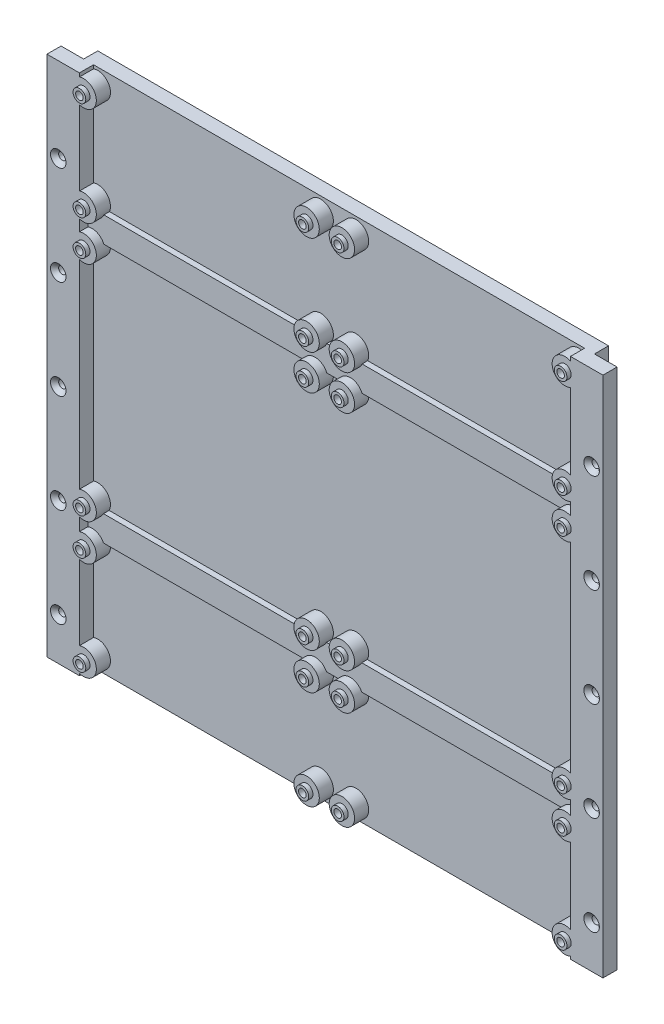
from build123d import *

# Parameters (mm, degrees)
MAIN_SKETCH_W                                  = 181
MAIN_SKETCH_H                                  = 185
MAIN_EXTRUSION_DEPTH                           = 2.5
HORIZONTAL_STRUCTURE_SKETCH_W                  = 181
HORIZONTAL_STRUCTURE_SKETCH_H                  = 5
HORIZONTAL_STRUCTURE_EXTRUSION_DEPTH           = 2.5
HORIZONTAL_STRUCTURE_LINEAR_REPEAT_COUNT       = 10
HORIZONTAL_STRUCTURE_LINEAR_REPEAT_PITCH       = 20
VERTICAL_STRUCTURE_SKETCH_W                    = 5
VERTICAL_STRUCTURE_SKETCH_H                    = 185
VERTICAL_STRUCTURE_EXTRUSION_DEPTH             = 2.5
VERTICAL_STRUCTURE_LINEAR_REPEAT_COUNT         = 9
VERTICAL_STRUCTURE_LINEAR_REPEAT_PITCH         = 22
PLOT_BASE_SKETCH_R                             = 4.5
PLOT_BASE_EXTRUSION_DEPTH                      = 5
PLOT_HEAD_SKETCH_R                             = 2.25
PLOT_HEAD_EXTRUSION_DEPTH                      = 1.5
PLOT_HEAD_HOLE_SKETCH_R                        = 1.35
PLOT_HEAD_HOLE_DEPTH                           = 130.918243523
MECHANICAL_BOARD_BOARD_FIRST_VERTICAL_COUNT    = 2
MECHANICAL_BOARD_BOARD_FIRST_VERTICAL_PITCH    = 35
MECHANICAL_MAIN_BOARD_FIRST_VERTICAL_L_COUNT   = 2
MECHANICAL_MAIN_BOARD_FIRST_VERTICAL_L_PITCH   = 48
MECHANICAL_MAIN_BOARD_SECOND_VERTICAL_COUNT    = 2
MECHANICAL_MAIN_BOARD_SECOND_VERTICAL_PITCH    = 127
MECHANICAL_MOTOR_BOARD_FIRST_VERTICAL_COUNT    = 2
MECHANICAL_MOTOR_BOARD_FIRST_VERTICAL_PITCH    = 139.5
MECHANICAL_MOTOR_BOARD_SECOND_VERTICAL_COUNT   = 2
MECHANICAL_MOTOR_BOARD_SECOND_VERTICAL_PITCH   = 174.5
RANGE_2_LINEAR_REPEAT_COUNT                    = 2
RANGE_2_LINEAR_REPEAT_PITCH                    = 79
RANGE_2_LINEAR_REPEAT_COPY_1_SKETCH_R          = 4.5
RANGE_2_LINEAR_REPEAT_COPY_1_DEPTH             = 5
RANGE_2_LINEAR_REPEAT_COPY_2_SKETCH_R          = 2.25
RANGE_2_LINEAR_REPEAT_COPY_2_DEPTH             = 1.5
RANGE_2_LINEAR_REPEAT_COPY_3_SKETCH_R          = 1.35
RANGE_2_LINEAR_REPEAT_COPY_3_DEPTH             = 130.918243523
RANGE_2_LINEAR_REPEAT_COPY_4_SKETCH_R          = 4.5
RANGE_2_LINEAR_REPEAT_COPY_4_DEPTH             = 5
RANGE_2_LINEAR_REPEAT_COPY_5_SKETCH_R          = 2.25
RANGE_2_LINEAR_REPEAT_COPY_5_DEPTH             = 1.5
RANGE_2_LINEAR_REPEAT_COPY_6_SKETCH_R          = 1.35
RANGE_2_LINEAR_REPEAT_COPY_6_DEPTH             = 130.918243523
RANGE_2_LINEAR_REPEAT_COPY_7_SKETCH_R          = 4.5
RANGE_2_LINEAR_REPEAT_COPY_7_DEPTH             = 5
RANGE_2_LINEAR_REPEAT_COPY_8_SKETCH_R          = 2.25
RANGE_2_LINEAR_REPEAT_COPY_8_DEPTH             = 1.5
RANGE_2_LINEAR_REPEAT_COPY_9_SKETCH_R          = 1.35
RANGE_2_LINEAR_REPEAT_COPY_9_DEPTH             = 130.918243523
RANGE_2_LINEAR_REPEAT_COPY_10_SKETCH_R         = 4.5
RANGE_2_LINEAR_REPEAT_COPY_10_DEPTH            = 5
RANGE_2_LINEAR_REPEAT_COPY_11_SKETCH_R         = 2.25
RANGE_2_LINEAR_REPEAT_COPY_11_DEPTH            = 1.5
RANGE_2_LINEAR_REPEAT_COPY_12_SKETCH_R         = 1.35
RANGE_2_LINEAR_REPEAT_COPY_12_DEPTH            = 130.918243523
RANGE_2_LINEAR_REPEAT_COPY_13_SKETCH_R         = 4.5
RANGE_2_LINEAR_REPEAT_COPY_13_DEPTH            = 5
RANGE_2_LINEAR_REPEAT_COPY_14_SKETCH_R         = 2.25
RANGE_2_LINEAR_REPEAT_COPY_14_DEPTH            = 1.5
RANGE_2_LINEAR_REPEAT_COPY_15_SKETCH_R         = 1.35
RANGE_2_LINEAR_REPEAT_COPY_15_DEPTH            = 130.918243523
RANGE_3_4_LINEAR_REPEAT_COUNT                  = 2
RANGE_3_4_LINEAR_REPEAT_PITCH                  = 91.5
RANGE_3_4_LINEAR_REPEAT_COPY_1_SKETCH_R        = 4.5
RANGE_3_4_LINEAR_REPEAT_COPY_1_DEPTH           = 5
RANGE_3_4_LINEAR_REPEAT_COPY_2_SKETCH_R        = 2.25
RANGE_3_4_LINEAR_REPEAT_COPY_2_DEPTH           = 1.5
RANGE_3_4_LINEAR_REPEAT_COPY_3_SKETCH_R        = 1.35
RANGE_3_4_LINEAR_REPEAT_COPY_3_DEPTH           = 130.918243523
RANGE_3_4_LINEAR_REPEAT_COPY_4_SKETCH_R        = 4.5
RANGE_3_4_LINEAR_REPEAT_COPY_4_DEPTH           = 5
RANGE_3_4_LINEAR_REPEAT_COPY_5_SKETCH_R        = 2.25
RANGE_3_4_LINEAR_REPEAT_COPY_5_DEPTH           = 1.5
RANGE_3_4_LINEAR_REPEAT_COPY_6_SKETCH_R        = 1.35
RANGE_3_4_LINEAR_REPEAT_COPY_6_DEPTH           = 130.918243523
RANGE_3_4_LINEAR_REPEAT_COPY_7_SKETCH_R        = 4.5
RANGE_3_4_LINEAR_REPEAT_COPY_7_DEPTH           = 5
RANGE_3_4_LINEAR_REPEAT_COPY_8_SKETCH_R        = 2.25
RANGE_3_4_LINEAR_REPEAT_COPY_8_DEPTH           = 1.5
RANGE_3_4_LINEAR_REPEAT_COPY_9_SKETCH_R        = 1.35
RANGE_3_4_LINEAR_REPEAT_COPY_9_DEPTH           = 130.918243523
RANGE_3_4_LINEAR_REPEAT_COPY_10_SKETCH_R       = 4.5
RANGE_3_4_LINEAR_REPEAT_COPY_10_DEPTH          = 5
RANGE_3_4_LINEAR_REPEAT_COPY_11_SKETCH_R       = 2.25
RANGE_3_4_LINEAR_REPEAT_COPY_11_DEPTH          = 1.5
RANGE_3_4_LINEAR_REPEAT_COPY_12_SKETCH_R       = 1.35
RANGE_3_4_LINEAR_REPEAT_COPY_12_DEPTH          = 130.918243523
RANGE_3_4_LINEAR_REPEAT_COPY_13_SKETCH_R       = 4.5
RANGE_3_4_LINEAR_REPEAT_COPY_13_DEPTH          = 5
RANGE_3_4_LINEAR_REPEAT_COPY_14_SKETCH_R       = 2.25
RANGE_3_4_LINEAR_REPEAT_COPY_14_DEPTH          = 1.5
RANGE_3_4_LINEAR_REPEAT_COPY_15_SKETCH_R       = 1.35
RANGE_3_4_LINEAR_REPEAT_COPY_15_DEPTH          = 130.918243523
RANGE_3_4_LINEAR_REPEAT_COPY_16_SKETCH_R       = 4.5
RANGE_3_4_LINEAR_REPEAT_COPY_16_DEPTH          = 5
RANGE_3_4_LINEAR_REPEAT_COPY_17_SKETCH_R       = 2.25
RANGE_3_4_LINEAR_REPEAT_COPY_17_DEPTH          = 1.5
RANGE_3_4_LINEAR_REPEAT_COPY_18_SKETCH_R       = 1.35
RANGE_3_4_LINEAR_REPEAT_COPY_18_DEPTH          = 130.918243523
RANGE_3_4_LINEAR_REPEAT_COPY_19_SKETCH_R       = 4.5
RANGE_3_4_LINEAR_REPEAT_COPY_19_DEPTH          = 5
RANGE_3_4_LINEAR_REPEAT_COPY_20_SKETCH_R       = 2.25
RANGE_3_4_LINEAR_REPEAT_COPY_20_DEPTH          = 1.5
RANGE_3_4_LINEAR_REPEAT_COPY_21_SKETCH_R       = 1.35
RANGE_3_4_LINEAR_REPEAT_COPY_21_DEPTH          = 130.918243523
RANGE_3_4_LINEAR_REPEAT_COPY_22_SKETCH_R       = 4.5
RANGE_3_4_LINEAR_REPEAT_COPY_22_DEPTH          = 5
RANGE_3_4_LINEAR_REPEAT_COPY_23_SKETCH_R       = 2.25
RANGE_3_4_LINEAR_REPEAT_COPY_23_DEPTH          = 1.5
RANGE_3_4_LINEAR_REPEAT_COPY_24_SKETCH_R       = 1.35
RANGE_3_4_LINEAR_REPEAT_COPY_24_DEPTH          = 130.918243523
RANGE_3_4_LINEAR_REPEAT_COPY_25_SKETCH_R       = 4.5
RANGE_3_4_LINEAR_REPEAT_COPY_25_DEPTH          = 5
RANGE_3_4_LINEAR_REPEAT_COPY_26_SKETCH_R       = 2.25
RANGE_3_4_LINEAR_REPEAT_COPY_26_DEPTH          = 1.5
RANGE_3_4_LINEAR_REPEAT_COPY_27_SKETCH_R       = 1.35
RANGE_3_4_LINEAR_REPEAT_COPY_27_DEPTH          = 130.918243523
RANGE_3_4_LINEAR_REPEAT_COPY_28_SKETCH_R       = 4.5
RANGE_3_4_LINEAR_REPEAT_COPY_28_DEPTH          = 5
RANGE_3_4_LINEAR_REPEAT_COPY_29_SKETCH_R       = 2.25
RANGE_3_4_LINEAR_REPEAT_COPY_29_DEPTH          = 1.5
RANGE_3_4_LINEAR_REPEAT_COPY_30_SKETCH_R       = 1.35
RANGE_3_4_LINEAR_REPEAT_COPY_30_DEPTH          = 130.918243523
RANGE_3_4_LINEAR_REPEAT_COPY_31_SKETCH_R       = 4.5
RANGE_3_4_LINEAR_REPEAT_COPY_31_DEPTH          = 5
RANGE_3_4_LINEAR_REPEAT_COPY_32_SKETCH_R       = 2.25
RANGE_3_4_LINEAR_REPEAT_COPY_32_DEPTH          = 1.5
RANGE_3_4_LINEAR_REPEAT_COPY_33_SKETCH_R       = 1.35
RANGE_3_4_LINEAR_REPEAT_COPY_33_DEPTH          = 130.918243523
FIX_SKETCH_W                                   = 11.5
FIX_SKETCH_H                                   = 185
FIX_EXTRUSION_DEPTH                            = 5
FRAISAGE_POUR_VIS_T_TE_FRAIS_E_M31_D           = 2.6
FRAISAGE_POUR_VIS_T_TE_FRAIS_E_M31_CSINK_D     = 5.5
FRAISAGE_POUR_VIS_T_TE_FRAIS_E_M31_CSINK_ANGLE = 90
R_P_TITION_LIN_AIRE11_COUNT                    = 5
R_P_TITION_LIN_AIRE11_PITCH                    = 35
SYM_TRIE1_COPY_1_D                             = 2.6
SYM_TRIE1_COPY_1_CSINK_D                       = 5.5
SYM_TRIE1_COPY_1_CSINK_ANGLE                   = 90
SYM_TRIE1_COPY_2_D                             = 2.6
SYM_TRIE1_COPY_2_CSINK_D                       = 5.5
SYM_TRIE1_COPY_2_CSINK_ANGLE                   = 90
SYM_TRIE1_COPY_3_D                             = 2.6
SYM_TRIE1_COPY_3_CSINK_D                       = 5.5
SYM_TRIE1_COPY_3_CSINK_ANGLE                   = 90
SYM_TRIE1_COPY_4_D                             = 2.6
SYM_TRIE1_COPY_4_CSINK_D                       = 5.5
SYM_TRIE1_COPY_4_CSINK_ANGLE                   = 90
CROSS_PLATE_1_W                                = 174
CROSS_PLATE_1_H                                = 9
CROSS_PLATE_1_EXTRUSION_DEPTH                  = 2
CROSS_PLATE_2_SKETCH_W                         = 174
CROSS_PLATE_2_SKETCH_H                         = 9
CROSS_PLATE_2_EXTRUSION_DEPTH                  = 2


with BuildPart() as part:
    # Main - Sketch → Main - Extrusion (new body)
    with BuildSketch(Plane.XY):
        Rectangle(MAIN_SKETCH_W, MAIN_SKETCH_H)
    extrude(amount=MAIN_EXTRUSION_DEPTH)

    # Horizontal Structure - Sketch → Horizontal Structure - Extrusion (add)
    with BuildSketch(Plane(origin=(0, 0, 0), x_dir=(-1, 0, 0), z_dir=(0, 0, -1))):
        with Locations((0, -90)):
            Rectangle(HORIZONTAL_STRUCTURE_SKETCH_W, HORIZONTAL_STRUCTURE_SKETCH_H)
    horizontal_structure_extrusion = extrude(amount=HORIZONTAL_STRUCTURE_EXTRUSION_DEPTH)

    # Horizontal Structure - Linear Repeat: Horizontal Structure - Extrusion ×10
    with Locations(*[(0, i * HORIZONTAL_STRUCTURE_LINEAR_REPEAT_PITCH, 0) for i in range(1, HORIZONTAL_STRUCTURE_LINEAR_REPEAT_COUNT)]):
        add(horizontal_structure_extrusion)

    # Vertical Structure - Sketch → Vertical Structure - Extrusion (add)
    with BuildSketch(Plane(origin=(0, 0, 0), x_dir=(-1, 0, 0), z_dir=(0, 0, -1))):
        with Locations((-88, 0)):
            Rectangle(VERTICAL_STRUCTURE_SKETCH_W, VERTICAL_STRUCTURE_SKETCH_H)
    vertical_structure_extrusion = extrude(amount=VERTICAL_STRUCTURE_EXTRUSION_DEPTH)

    # Vertical Structure - Linear Repeat: Vertical Structure - Extrusion ×9
    with Locations(*[(-i * VERTICAL_STRUCTURE_LINEAR_REPEAT_PITCH, 0, 0) for i in range(1, VERTICAL_STRUCTURE_LINEAR_REPEAT_COUNT)]):
        add(vertical_structure_extrusion)

    # Plot Base - Sketch → Plot-Base - Extrusion (add)
    with BuildSketch(Plane.XY.offset(2.5)):
        with Locations(Location((-85.5, -87.5, 0), (0, 0, 180))):
            Circle(PLOT_BASE_SKETCH_R)
    plot_base_extrusion = extrude(amount=PLOT_BASE_EXTRUSION_DEPTH)

    # Plot Head - Sketch → Plot Head - Extrusion (add)
    with BuildSketch(Plane.XY.offset(7.5)):
        with Locations((-85.5, -87.5)):
            Circle(PLOT_HEAD_SKETCH_R)
    plot_head_extrusion = extrude(amount=PLOT_HEAD_EXTRUSION_DEPTH)

    # Plot Head Hole Sketch → Plot Head Hole (cut, through all)
    with BuildSketch(Plane.XY.offset(9)):
        with Locations((-85.5, -87.5)):
            Circle(PLOT_HEAD_HOLE_SKETCH_R)
    plot_head_hole = extrude(amount=-PLOT_HEAD_HOLE_DEPTH, mode=Mode.SUBTRACT)

    # Mechanical Board Board - First Vertical Linear Repeat: Plot-Base - Extrusion, Plot Head - Extrusion, Plot Head Hole ×2
    with Locations(*[(0, i * MECHANICAL_BOARD_BOARD_FIRST_VERTICAL_PITCH, 0) for i in range(1, MECHANICAL_BOARD_BOARD_FIRST_VERTICAL_COUNT)]):
        add(plot_base_extrusion)
        add(plot_head_extrusion)
        add(plot_head_hole, mode=Mode.SUBTRACT)

    # Mechanical Main Board - First Vertical Linear Repeat: Plot-Base - Extrusion, Plot Head - Extrusion, Plot Head Hole ×2
    with Locations(*[(0, i * MECHANICAL_MAIN_BOARD_FIRST_VERTICAL_L_PITCH, 0) for i in range(1, MECHANICAL_MAIN_BOARD_FIRST_VERTICAL_L_COUNT)]):
        add(plot_base_extrusion)
        add(plot_head_extrusion)
        add(plot_head_hole, mode=Mode.SUBTRACT)

    # Mechanical Main Board - Second Vertical Linear Repeat: Plot-Base - Extrusion, Plot Head - Extrusion, Plot Head Hole ×2
    with Locations(*[(0, i * MECHANICAL_MAIN_BOARD_SECOND_VERTICAL_PITCH, 0) for i in range(1, MECHANICAL_MAIN_BOARD_SECOND_VERTICAL_COUNT)]):
        add(plot_base_extrusion)
        add(plot_head_extrusion)
        add(plot_head_hole, mode=Mode.SUBTRACT)

    # Mechanical Motor Board - First Vertical Linear Repeat: Plot-Base - Extrusion, Plot Head - Extrusion, Plot Head Hole ×2
    with Locations(*[(0, i * MECHANICAL_MOTOR_BOARD_FIRST_VERTICAL_PITCH, 0) for i in range(1, MECHANICAL_MOTOR_BOARD_FIRST_VERTICAL_COUNT)]):
        add(plot_base_extrusion)
        add(plot_head_extrusion)
        add(plot_head_hole, mode=Mode.SUBTRACT)

    # Mechanical Motor Board - Second Vertical Linear Repeat: Plot-Base - Extrusion, Plot Head - Extrusion, Plot Head Hole ×2
    with Locations(*[(0, i * MECHANICAL_MOTOR_BOARD_SECOND_VERTICAL_PITCH, 0) for i in range(1, MECHANICAL_MOTOR_BOARD_SECOND_VERTICAL_COUNT)]):
        add(plot_base_extrusion)
        add(plot_head_extrusion)
        add(plot_head_hole, mode=Mode.SUBTRACT)

    # Range 2 - Linear Repeat: Plot-Base - Extrusion, Plot Head - Extrusion, Plot Head Hole ×2
    with Locations(*[(i * RANGE_2_LINEAR_REPEAT_PITCH, 0, 0) for i in range(1, RANGE_2_LINEAR_REPEAT_COUNT)]):
        add(plot_base_extrusion)
        add(plot_head_extrusion)
        add(plot_head_hole, mode=Mode.SUBTRACT)

    # Range 2 - Linear Repeat copy 1 sketch → Range 2 - Linear Repeat copy 1 (add)
    with BuildSketch(Plane(origin=(79, 35, 2.5), x_dir=(1, 0, 0), z_dir=(0, 0, 1))):
        with Locations(Location((-85.5, -87.5, 0), (0, 0, 180))):
            Circle(RANGE_2_LINEAR_REPEAT_COPY_1_SKETCH_R)
    extrude(amount=RANGE_2_LINEAR_REPEAT_COPY_1_DEPTH)

    # Range 2 - Linear Repeat copy 2 sketch → Range 2 - Linear Repeat copy 2 (add)
    with BuildSketch(Plane(origin=(79, 35, 7.5), x_dir=(1, 0, 0), z_dir=(0, 0, 1))):
        with Locations((-85.5, -87.5)):
            Circle(RANGE_2_LINEAR_REPEAT_COPY_2_SKETCH_R)
    extrude(amount=RANGE_2_LINEAR_REPEAT_COPY_2_DEPTH)

    # Range 2 - Linear Repeat copy 3 sketch → Range 2 - Linear Repeat copy 3 (cut, through all)
    with BuildSketch(Plane(origin=(79, 35, 9), x_dir=(1, 0, 0), z_dir=(0, 0, 1))):
        with Locations((-85.5, -87.5)):
            Circle(RANGE_2_LINEAR_REPEAT_COPY_3_SKETCH_R)
    extrude(amount=-RANGE_2_LINEAR_REPEAT_COPY_3_DEPTH, mode=Mode.SUBTRACT)

    # Range 2 - Linear Repeat copy 4 sketch → Range 2 - Linear Repeat copy 4 (add)
    with BuildSketch(Plane(origin=(79, 48, 2.5), x_dir=(1, 0, 0), z_dir=(0, 0, 1))):
        with Locations(Location((-85.5, -87.5, 0), (0, 0, 180))):
            Circle(RANGE_2_LINEAR_REPEAT_COPY_4_SKETCH_R)
    extrude(amount=RANGE_2_LINEAR_REPEAT_COPY_4_DEPTH)

    # Range 2 - Linear Repeat copy 5 sketch → Range 2 - Linear Repeat copy 5 (add)
    with BuildSketch(Plane(origin=(79, 48, 7.5), x_dir=(1, 0, 0), z_dir=(0, 0, 1))):
        with Locations((-85.5, -87.5)):
            Circle(RANGE_2_LINEAR_REPEAT_COPY_5_SKETCH_R)
    extrude(amount=RANGE_2_LINEAR_REPEAT_COPY_5_DEPTH)

    # Range 2 - Linear Repeat copy 6 sketch → Range 2 - Linear Repeat copy 6 (cut, through all)
    with BuildSketch(Plane(origin=(79, 48, 9), x_dir=(1, 0, 0), z_dir=(0, 0, 1))):
        with Locations((-85.5, -87.5)):
            Circle(RANGE_2_LINEAR_REPEAT_COPY_6_SKETCH_R)
    extrude(amount=-RANGE_2_LINEAR_REPEAT_COPY_6_DEPTH, mode=Mode.SUBTRACT)

    # Range 2 - Linear Repeat copy 7 sketch → Range 2 - Linear Repeat copy 7 (add)
    with BuildSketch(Plane(origin=(79, 127, 2.5), x_dir=(1, 0, 0), z_dir=(0, 0, 1))):
        with Locations(Location((-85.5, -87.5, 0), (0, 0, 180))):
            Circle(RANGE_2_LINEAR_REPEAT_COPY_7_SKETCH_R)
    extrude(amount=RANGE_2_LINEAR_REPEAT_COPY_7_DEPTH)

    # Range 2 - Linear Repeat copy 8 sketch → Range 2 - Linear Repeat copy 8 (add)
    with BuildSketch(Plane(origin=(79, 127, 7.5), x_dir=(1, 0, 0), z_dir=(0, 0, 1))):
        with Locations((-85.5, -87.5)):
            Circle(RANGE_2_LINEAR_REPEAT_COPY_8_SKETCH_R)
    extrude(amount=RANGE_2_LINEAR_REPEAT_COPY_8_DEPTH)

    # Range 2 - Linear Repeat copy 9 sketch → Range 2 - Linear Repeat copy 9 (cut, through all)
    with BuildSketch(Plane(origin=(79, 127, 9), x_dir=(1, 0, 0), z_dir=(0, 0, 1))):
        with Locations((-85.5, -87.5)):
            Circle(RANGE_2_LINEAR_REPEAT_COPY_9_SKETCH_R)
    extrude(amount=-RANGE_2_LINEAR_REPEAT_COPY_9_DEPTH, mode=Mode.SUBTRACT)

    # Range 2 - Linear Repeat copy 10 sketch → Range 2 - Linear Repeat copy 10 (add)
    with BuildSketch(Plane(origin=(79, 139.5, 2.5), x_dir=(1, 0, 0), z_dir=(0, 0, 1))):
        with Locations(Location((-85.5, -87.5, 0), (0, 0, 180))):
            Circle(RANGE_2_LINEAR_REPEAT_COPY_10_SKETCH_R)
    extrude(amount=RANGE_2_LINEAR_REPEAT_COPY_10_DEPTH)

    # Range 2 - Linear Repeat copy 11 sketch → Range 2 - Linear Repeat copy 11 (add)
    with BuildSketch(Plane(origin=(79, 139.5, 7.5), x_dir=(1, 0, 0), z_dir=(0, 0, 1))):
        with Locations((-85.5, -87.5)):
            Circle(RANGE_2_LINEAR_REPEAT_COPY_11_SKETCH_R)
    extrude(amount=RANGE_2_LINEAR_REPEAT_COPY_11_DEPTH)

    # Range 2 - Linear Repeat copy 12 sketch → Range 2 - Linear Repeat copy 12 (cut, through all)
    with BuildSketch(Plane(origin=(79, 139.5, 9), x_dir=(1, 0, 0), z_dir=(0, 0, 1))):
        with Locations((-85.5, -87.5)):
            Circle(RANGE_2_LINEAR_REPEAT_COPY_12_SKETCH_R)
    extrude(amount=-RANGE_2_LINEAR_REPEAT_COPY_12_DEPTH, mode=Mode.SUBTRACT)

    # Range 2 - Linear Repeat copy 13 sketch → Range 2 - Linear Repeat copy 13 (add)
    with BuildSketch(Plane(origin=(79, 174.5, 2.5), x_dir=(1, 0, 0), z_dir=(0, 0, 1))):
        with Locations(Location((-85.5, -87.5, 0), (0, 0, 180))):
            Circle(RANGE_2_LINEAR_REPEAT_COPY_13_SKETCH_R)
    extrude(amount=RANGE_2_LINEAR_REPEAT_COPY_13_DEPTH)

    # Range 2 - Linear Repeat copy 14 sketch → Range 2 - Linear Repeat copy 14 (add)
    with BuildSketch(Plane(origin=(79, 174.5, 7.5), x_dir=(1, 0, 0), z_dir=(0, 0, 1))):
        with Locations((-85.5, -87.5)):
            Circle(RANGE_2_LINEAR_REPEAT_COPY_14_SKETCH_R)
    extrude(amount=RANGE_2_LINEAR_REPEAT_COPY_14_DEPTH)

    # Range 2 - Linear Repeat copy 15 sketch → Range 2 - Linear Repeat copy 15 (cut, through all)
    with BuildSketch(Plane(origin=(79, 174.5, 9), x_dir=(1, 0, 0), z_dir=(0, 0, 1))):
        with Locations((-85.5, -87.5)):
            Circle(RANGE_2_LINEAR_REPEAT_COPY_15_SKETCH_R)
    extrude(amount=-RANGE_2_LINEAR_REPEAT_COPY_15_DEPTH, mode=Mode.SUBTRACT)

    # Range 3-4 - Linear Repeat: Plot-Base - Extrusion, Plot Head - Extrusion, Plot Head Hole ×2
    with Locations(*[(i * RANGE_3_4_LINEAR_REPEAT_PITCH, 0, 0) for i in range(1, RANGE_3_4_LINEAR_REPEAT_COUNT)]):
        add(plot_base_extrusion)
        add(plot_head_extrusion)
        add(plot_head_hole, mode=Mode.SUBTRACT)

    # Range 3-4 - Linear Repeat copy 1 sketch → Range 3-4 - Linear Repeat copy 1 (add)
    with BuildSketch(Plane(origin=(91.5, 35, 2.5), x_dir=(1, 0, 0), z_dir=(0, 0, 1))):
        with Locations(Location((-85.5, -87.5, 0), (0, 0, 180))):
            Circle(RANGE_3_4_LINEAR_REPEAT_COPY_1_SKETCH_R)
    extrude(amount=RANGE_3_4_LINEAR_REPEAT_COPY_1_DEPTH)

    # Range 3-4 - Linear Repeat copy 2 sketch → Range 3-4 - Linear Repeat copy 2 (add)
    with BuildSketch(Plane(origin=(91.5, 35, 7.5), x_dir=(1, 0, 0), z_dir=(0, 0, 1))):
        with Locations((-85.5, -87.5)):
            Circle(RANGE_3_4_LINEAR_REPEAT_COPY_2_SKETCH_R)
    extrude(amount=RANGE_3_4_LINEAR_REPEAT_COPY_2_DEPTH)

    # Range 3-4 - Linear Repeat copy 3 sketch → Range 3-4 - Linear Repeat copy 3 (cut, through all)
    with BuildSketch(Plane(origin=(91.5, 35, 9), x_dir=(1, 0, 0), z_dir=(0, 0, 1))):
        with Locations((-85.5, -87.5)):
            Circle(RANGE_3_4_LINEAR_REPEAT_COPY_3_SKETCH_R)
    extrude(amount=-RANGE_3_4_LINEAR_REPEAT_COPY_3_DEPTH, mode=Mode.SUBTRACT)

    # Range 3-4 - Linear Repeat copy 4 sketch → Range 3-4 - Linear Repeat copy 4 (add)
    with BuildSketch(Plane(origin=(91.5, 48, 2.5), x_dir=(1, 0, 0), z_dir=(0, 0, 1))):
        with Locations(Location((-85.5, -87.5, 0), (0, 0, 180))):
            Circle(RANGE_3_4_LINEAR_REPEAT_COPY_4_SKETCH_R)
    extrude(amount=RANGE_3_4_LINEAR_REPEAT_COPY_4_DEPTH)

    # Range 3-4 - Linear Repeat copy 5 sketch → Range 3-4 - Linear Repeat copy 5 (add)
    with BuildSketch(Plane(origin=(91.5, 48, 7.5), x_dir=(1, 0, 0), z_dir=(0, 0, 1))):
        with Locations((-85.5, -87.5)):
            Circle(RANGE_3_4_LINEAR_REPEAT_COPY_5_SKETCH_R)
    extrude(amount=RANGE_3_4_LINEAR_REPEAT_COPY_5_DEPTH)

    # Range 3-4 - Linear Repeat copy 6 sketch → Range 3-4 - Linear Repeat copy 6 (cut, through all)
    with BuildSketch(Plane(origin=(91.5, 48, 9), x_dir=(1, 0, 0), z_dir=(0, 0, 1))):
        with Locations((-85.5, -87.5)):
            Circle(RANGE_3_4_LINEAR_REPEAT_COPY_6_SKETCH_R)
    extrude(amount=-RANGE_3_4_LINEAR_REPEAT_COPY_6_DEPTH, mode=Mode.SUBTRACT)

    # Range 3-4 - Linear Repeat copy 7 sketch → Range 3-4 - Linear Repeat copy 7 (add)
    with BuildSketch(Plane(origin=(91.5, 127, 2.5), x_dir=(1, 0, 0), z_dir=(0, 0, 1))):
        with Locations(Location((-85.5, -87.5, 0), (0, 0, 180))):
            Circle(RANGE_3_4_LINEAR_REPEAT_COPY_7_SKETCH_R)
    extrude(amount=RANGE_3_4_LINEAR_REPEAT_COPY_7_DEPTH)

    # Range 3-4 - Linear Repeat copy 8 sketch → Range 3-4 - Linear Repeat copy 8 (add)
    with BuildSketch(Plane(origin=(91.5, 127, 7.5), x_dir=(1, 0, 0), z_dir=(0, 0, 1))):
        with Locations((-85.5, -87.5)):
            Circle(RANGE_3_4_LINEAR_REPEAT_COPY_8_SKETCH_R)
    extrude(amount=RANGE_3_4_LINEAR_REPEAT_COPY_8_DEPTH)

    # Range 3-4 - Linear Repeat copy 9 sketch → Range 3-4 - Linear Repeat copy 9 (cut, through all)
    with BuildSketch(Plane(origin=(91.5, 127, 9), x_dir=(1, 0, 0), z_dir=(0, 0, 1))):
        with Locations((-85.5, -87.5)):
            Circle(RANGE_3_4_LINEAR_REPEAT_COPY_9_SKETCH_R)
    extrude(amount=-RANGE_3_4_LINEAR_REPEAT_COPY_9_DEPTH, mode=Mode.SUBTRACT)

    # Range 3-4 - Linear Repeat copy 10 sketch → Range 3-4 - Linear Repeat copy 10 (add)
    with BuildSketch(Plane(origin=(91.5, 139.5, 2.5), x_dir=(1, 0, 0), z_dir=(0, 0, 1))):
        with Locations(Location((-85.5, -87.5, 0), (0, 0, 180))):
            Circle(RANGE_3_4_LINEAR_REPEAT_COPY_10_SKETCH_R)
    extrude(amount=RANGE_3_4_LINEAR_REPEAT_COPY_10_DEPTH)

    # Range 3-4 - Linear Repeat copy 11 sketch → Range 3-4 - Linear Repeat copy 11 (add)
    with BuildSketch(Plane(origin=(91.5, 139.5, 7.5), x_dir=(1, 0, 0), z_dir=(0, 0, 1))):
        with Locations((-85.5, -87.5)):
            Circle(RANGE_3_4_LINEAR_REPEAT_COPY_11_SKETCH_R)
    extrude(amount=RANGE_3_4_LINEAR_REPEAT_COPY_11_DEPTH)

    # Range 3-4 - Linear Repeat copy 12 sketch → Range 3-4 - Linear Repeat copy 12 (cut, through all)
    with BuildSketch(Plane(origin=(91.5, 139.5, 9), x_dir=(1, 0, 0), z_dir=(0, 0, 1))):
        with Locations((-85.5, -87.5)):
            Circle(RANGE_3_4_LINEAR_REPEAT_COPY_12_SKETCH_R)
    extrude(amount=-RANGE_3_4_LINEAR_REPEAT_COPY_12_DEPTH, mode=Mode.SUBTRACT)

    # Range 3-4 - Linear Repeat copy 13 sketch → Range 3-4 - Linear Repeat copy 13 (add)
    with BuildSketch(Plane(origin=(91.5, 174.5, 2.5), x_dir=(1, 0, 0), z_dir=(0, 0, 1))):
        with Locations(Location((-85.5, -87.5, 0), (0, 0, 180))):
            Circle(RANGE_3_4_LINEAR_REPEAT_COPY_13_SKETCH_R)
    extrude(amount=RANGE_3_4_LINEAR_REPEAT_COPY_13_DEPTH)

    # Range 3-4 - Linear Repeat copy 14 sketch → Range 3-4 - Linear Repeat copy 14 (add)
    with BuildSketch(Plane(origin=(91.5, 174.5, 7.5), x_dir=(1, 0, 0), z_dir=(0, 0, 1))):
        with Locations((-85.5, -87.5)):
            Circle(RANGE_3_4_LINEAR_REPEAT_COPY_14_SKETCH_R)
    extrude(amount=RANGE_3_4_LINEAR_REPEAT_COPY_14_DEPTH)

    # Range 3-4 - Linear Repeat copy 15 sketch → Range 3-4 - Linear Repeat copy 15 (cut, through all)
    with BuildSketch(Plane(origin=(91.5, 174.5, 9), x_dir=(1, 0, 0), z_dir=(0, 0, 1))):
        with Locations((-85.5, -87.5)):
            Circle(RANGE_3_4_LINEAR_REPEAT_COPY_15_SKETCH_R)
    extrude(amount=-RANGE_3_4_LINEAR_REPEAT_COPY_15_DEPTH, mode=Mode.SUBTRACT)

    # Range 3-4 - Linear Repeat copy 16 sketch → Range 3-4 - Linear Repeat copy 16 (add)
    with BuildSketch(Plane(origin=(170.5, 0, 2.5), x_dir=(1, 0, 0), z_dir=(0, 0, 1))):
        with Locations(Location((-85.5, -87.5, 0), (0, 0, 180))):
            Circle(RANGE_3_4_LINEAR_REPEAT_COPY_16_SKETCH_R)
    extrude(amount=RANGE_3_4_LINEAR_REPEAT_COPY_16_DEPTH)

    # Range 3-4 - Linear Repeat copy 17 sketch → Range 3-4 - Linear Repeat copy 17 (add)
    with BuildSketch(Plane(origin=(170.5, 0, 7.5), x_dir=(1, 0, 0), z_dir=(0, 0, 1))):
        with Locations((-85.5, -87.5)):
            Circle(RANGE_3_4_LINEAR_REPEAT_COPY_17_SKETCH_R)
    extrude(amount=RANGE_3_4_LINEAR_REPEAT_COPY_17_DEPTH)

    # Range 3-4 - Linear Repeat copy 18 sketch → Range 3-4 - Linear Repeat copy 18 (cut, through all)
    with BuildSketch(Plane(origin=(170.5, 0, 9), x_dir=(1, 0, 0), z_dir=(0, 0, 1))):
        with Locations((-85.5, -87.5)):
            Circle(RANGE_3_4_LINEAR_REPEAT_COPY_18_SKETCH_R)
    extrude(amount=-RANGE_3_4_LINEAR_REPEAT_COPY_18_DEPTH, mode=Mode.SUBTRACT)

    # Range 3-4 - Linear Repeat copy 19 sketch → Range 3-4 - Linear Repeat copy 19 (add)
    with BuildSketch(Plane(origin=(170.5, 35, 2.5), x_dir=(1, 0, 0), z_dir=(0, 0, 1))):
        with Locations(Location((-85.5, -87.5, 0), (0, 0, 180))):
            Circle(RANGE_3_4_LINEAR_REPEAT_COPY_19_SKETCH_R)
    extrude(amount=RANGE_3_4_LINEAR_REPEAT_COPY_19_DEPTH)

    # Range 3-4 - Linear Repeat copy 20 sketch → Range 3-4 - Linear Repeat copy 20 (add)
    with BuildSketch(Plane(origin=(170.5, 35, 7.5), x_dir=(1, 0, 0), z_dir=(0, 0, 1))):
        with Locations((-85.5, -87.5)):
            Circle(RANGE_3_4_LINEAR_REPEAT_COPY_20_SKETCH_R)
    extrude(amount=RANGE_3_4_LINEAR_REPEAT_COPY_20_DEPTH)

    # Range 3-4 - Linear Repeat copy 21 sketch → Range 3-4 - Linear Repeat copy 21 (cut, through all)
    with BuildSketch(Plane(origin=(170.5, 35, 9), x_dir=(1, 0, 0), z_dir=(0, 0, 1))):
        with Locations((-85.5, -87.5)):
            Circle(RANGE_3_4_LINEAR_REPEAT_COPY_21_SKETCH_R)
    extrude(amount=-RANGE_3_4_LINEAR_REPEAT_COPY_21_DEPTH, mode=Mode.SUBTRACT)

    # Range 3-4 - Linear Repeat copy 22 sketch → Range 3-4 - Linear Repeat copy 22 (add)
    with BuildSketch(Plane(origin=(170.5, 48, 2.5), x_dir=(1, 0, 0), z_dir=(0, 0, 1))):
        with Locations(Location((-85.5, -87.5, 0), (0, 0, 180))):
            Circle(RANGE_3_4_LINEAR_REPEAT_COPY_22_SKETCH_R)
    extrude(amount=RANGE_3_4_LINEAR_REPEAT_COPY_22_DEPTH)

    # Range 3-4 - Linear Repeat copy 23 sketch → Range 3-4 - Linear Repeat copy 23 (add)
    with BuildSketch(Plane(origin=(170.5, 48, 7.5), x_dir=(1, 0, 0), z_dir=(0, 0, 1))):
        with Locations((-85.5, -87.5)):
            Circle(RANGE_3_4_LINEAR_REPEAT_COPY_23_SKETCH_R)
    extrude(amount=RANGE_3_4_LINEAR_REPEAT_COPY_23_DEPTH)

    # Range 3-4 - Linear Repeat copy 24 sketch → Range 3-4 - Linear Repeat copy 24 (cut, through all)
    with BuildSketch(Plane(origin=(170.5, 48, 9), x_dir=(1, 0, 0), z_dir=(0, 0, 1))):
        with Locations((-85.5, -87.5)):
            Circle(RANGE_3_4_LINEAR_REPEAT_COPY_24_SKETCH_R)
    extrude(amount=-RANGE_3_4_LINEAR_REPEAT_COPY_24_DEPTH, mode=Mode.SUBTRACT)

    # Range 3-4 - Linear Repeat copy 25 sketch → Range 3-4 - Linear Repeat copy 25 (add)
    with BuildSketch(Plane(origin=(170.5, 127, 2.5), x_dir=(1, 0, 0), z_dir=(0, 0, 1))):
        with Locations(Location((-85.5, -87.5, 0), (0, 0, 180))):
            Circle(RANGE_3_4_LINEAR_REPEAT_COPY_25_SKETCH_R)
    extrude(amount=RANGE_3_4_LINEAR_REPEAT_COPY_25_DEPTH)

    # Range 3-4 - Linear Repeat copy 26 sketch → Range 3-4 - Linear Repeat copy 26 (add)
    with BuildSketch(Plane(origin=(170.5, 127, 7.5), x_dir=(1, 0, 0), z_dir=(0, 0, 1))):
        with Locations((-85.5, -87.5)):
            Circle(RANGE_3_4_LINEAR_REPEAT_COPY_26_SKETCH_R)
    extrude(amount=RANGE_3_4_LINEAR_REPEAT_COPY_26_DEPTH)

    # Range 3-4 - Linear Repeat copy 27 sketch → Range 3-4 - Linear Repeat copy 27 (cut, through all)
    with BuildSketch(Plane(origin=(170.5, 127, 9), x_dir=(1, 0, 0), z_dir=(0, 0, 1))):
        with Locations((-85.5, -87.5)):
            Circle(RANGE_3_4_LINEAR_REPEAT_COPY_27_SKETCH_R)
    extrude(amount=-RANGE_3_4_LINEAR_REPEAT_COPY_27_DEPTH, mode=Mode.SUBTRACT)

    # Range 3-4 - Linear Repeat copy 28 sketch → Range 3-4 - Linear Repeat copy 28 (add)
    with BuildSketch(Plane(origin=(170.5, 139.5, 2.5), x_dir=(1, 0, 0), z_dir=(0, 0, 1))):
        with Locations(Location((-85.5, -87.5, 0), (0, 0, 180))):
            Circle(RANGE_3_4_LINEAR_REPEAT_COPY_28_SKETCH_R)
    extrude(amount=RANGE_3_4_LINEAR_REPEAT_COPY_28_DEPTH)

    # Range 3-4 - Linear Repeat copy 29 sketch → Range 3-4 - Linear Repeat copy 29 (add)
    with BuildSketch(Plane(origin=(170.5, 139.5, 7.5), x_dir=(1, 0, 0), z_dir=(0, 0, 1))):
        with Locations((-85.5, -87.5)):
            Circle(RANGE_3_4_LINEAR_REPEAT_COPY_29_SKETCH_R)
    extrude(amount=RANGE_3_4_LINEAR_REPEAT_COPY_29_DEPTH)

    # Range 3-4 - Linear Repeat copy 30 sketch → Range 3-4 - Linear Repeat copy 30 (cut, through all)
    with BuildSketch(Plane(origin=(170.5, 139.5, 9), x_dir=(1, 0, 0), z_dir=(0, 0, 1))):
        with Locations((-85.5, -87.5)):
            Circle(RANGE_3_4_LINEAR_REPEAT_COPY_30_SKETCH_R)
    extrude(amount=-RANGE_3_4_LINEAR_REPEAT_COPY_30_DEPTH, mode=Mode.SUBTRACT)

    # Range 3-4 - Linear Repeat copy 31 sketch → Range 3-4 - Linear Repeat copy 31 (add)
    with BuildSketch(Plane(origin=(170.5, 174.5, 2.5), x_dir=(1, 0, 0), z_dir=(0, 0, 1))):
        with Locations(Location((-85.5, -87.5, 0), (0, 0, 180))):
            Circle(RANGE_3_4_LINEAR_REPEAT_COPY_31_SKETCH_R)
    extrude(amount=RANGE_3_4_LINEAR_REPEAT_COPY_31_DEPTH)

    # Range 3-4 - Linear Repeat copy 32 sketch → Range 3-4 - Linear Repeat copy 32 (add)
    with BuildSketch(Plane(origin=(170.5, 174.5, 7.5), x_dir=(1, 0, 0), z_dir=(0, 0, 1))):
        with Locations((-85.5, -87.5)):
            Circle(RANGE_3_4_LINEAR_REPEAT_COPY_32_SKETCH_R)
    extrude(amount=RANGE_3_4_LINEAR_REPEAT_COPY_32_DEPTH)

    # Range 3-4 - Linear Repeat copy 33 sketch → Range 3-4 - Linear Repeat copy 33 (cut, through all)
    with BuildSketch(Plane(origin=(170.5, 174.5, 9), x_dir=(1, 0, 0), z_dir=(0, 0, 1))):
        with Locations((-85.5, -87.5)):
            Circle(RANGE_3_4_LINEAR_REPEAT_COPY_33_SKETCH_R)
    extrude(amount=-RANGE_3_4_LINEAR_REPEAT_COPY_33_DEPTH, mode=Mode.SUBTRACT)

    # Fix - Sketch → Fix - Extrusion (add)
    with BuildSketch(Plane.XY.offset(2.5)):
        with Locations((-92.75, 0)):
            Rectangle(FIX_SKETCH_W, FIX_SKETCH_H)
    fix_extrusion = extrude(amount=FIX_EXTRUSION_DEPTH)

    # Fraisage pour vis à tête fraisée M31 (through all)
    with Locations(Plane.XY.offset(7.5)):
        with Locations((-94.5, 62.5)):
            fraisage_pour_vis_t_te_frais_e_m31 = CounterSinkHole(FRAISAGE_POUR_VIS_T_TE_FRAIS_E_M31_D / 2, FRAISAGE_POUR_VIS_T_TE_FRAIS_E_M31_CSINK_D / 2, counter_sink_angle=FRAISAGE_POUR_VIS_T_TE_FRAIS_E_M31_CSINK_ANGLE)

    # Répétition linéaire11: Fraisage pour vis à tête fraisée M31 ×5
    with Locations(*[(0, -i * R_P_TITION_LIN_AIRE11_PITCH, 0) for i in range(1, R_P_TITION_LIN_AIRE11_COUNT)]):
        add(fraisage_pour_vis_t_te_frais_e_m31, mode=Mode.SUBTRACT)

    # Symétrie1: Fix - Extrusion, Fraisage pour vis à tête fraisée M31 across plane
    add(fix_extrusion.mirror(Plane(origin=(0, 0, 0), x_dir=(0, 0, 1), z_dir=(1, 0, 0))))
    add(fraisage_pour_vis_t_te_frais_e_m31.mirror(Plane(origin=(0, 0, 0), x_dir=(0, 0, 1), z_dir=(1, 0, 0))), mode=Mode.SUBTRACT)

    # Symétrie1 copy 1 (through all)
    with Locations(Plane(origin=(0, -35, 7.5), x_dir=(-1, 0, 0), z_dir=(0, 0, 1))):
        with Locations((-94.5, -62.5)):
            CounterSinkHole(SYM_TRIE1_COPY_1_D / 2, SYM_TRIE1_COPY_1_CSINK_D / 2, counter_sink_angle=SYM_TRIE1_COPY_1_CSINK_ANGLE)

    # Symétrie1 copy 2 (through all)
    with Locations(Plane(origin=(0, -70, 7.5), x_dir=(-1, 0, 0), z_dir=(0, 0, 1))):
        with Locations((-94.5, -62.5)):
            CounterSinkHole(SYM_TRIE1_COPY_2_D / 2, SYM_TRIE1_COPY_2_CSINK_D / 2, counter_sink_angle=SYM_TRIE1_COPY_2_CSINK_ANGLE)

    # Symétrie1 copy 3 (through all)
    with Locations(Plane(origin=(0, -105, 7.5), x_dir=(-1, 0, 0), z_dir=(0, 0, 1))):
        with Locations((-94.5, -62.5)):
            CounterSinkHole(SYM_TRIE1_COPY_3_D / 2, SYM_TRIE1_COPY_3_CSINK_D / 2, counter_sink_angle=SYM_TRIE1_COPY_3_CSINK_ANGLE)

    # Symétrie1 copy 4 (through all)
    with Locations(Plane(origin=(0, -140, 7.5), x_dir=(-1, 0, 0), z_dir=(0, 0, 1))):
        with Locations((-94.5, -62.5)):
            CounterSinkHole(SYM_TRIE1_COPY_4_D / 2, SYM_TRIE1_COPY_4_CSINK_D / 2, counter_sink_angle=SYM_TRIE1_COPY_4_CSINK_ANGLE)

    # Cross Plate 1 → Cross Plate 1 - Extrusion (add)
    with BuildSketch(Plane.XY.offset(2.5)):
        with Locations((0, 45.75)):
            Rectangle(CROSS_PLATE_1_W, CROSS_PLATE_1_H)
    extrude(amount=CROSS_PLATE_1_EXTRUSION_DEPTH)

    # Cross Plate 2 - Sketch → Cross Plate 2 - Extrusion (add)
    with BuildSketch(Plane.XY.offset(2.5)):
        with Locations((0, -46)):
            Rectangle(CROSS_PLATE_2_SKETCH_W, CROSS_PLATE_2_SKETCH_H)
    extrude(amount=CROSS_PLATE_2_EXTRUSION_DEPTH)


solid = part.part
